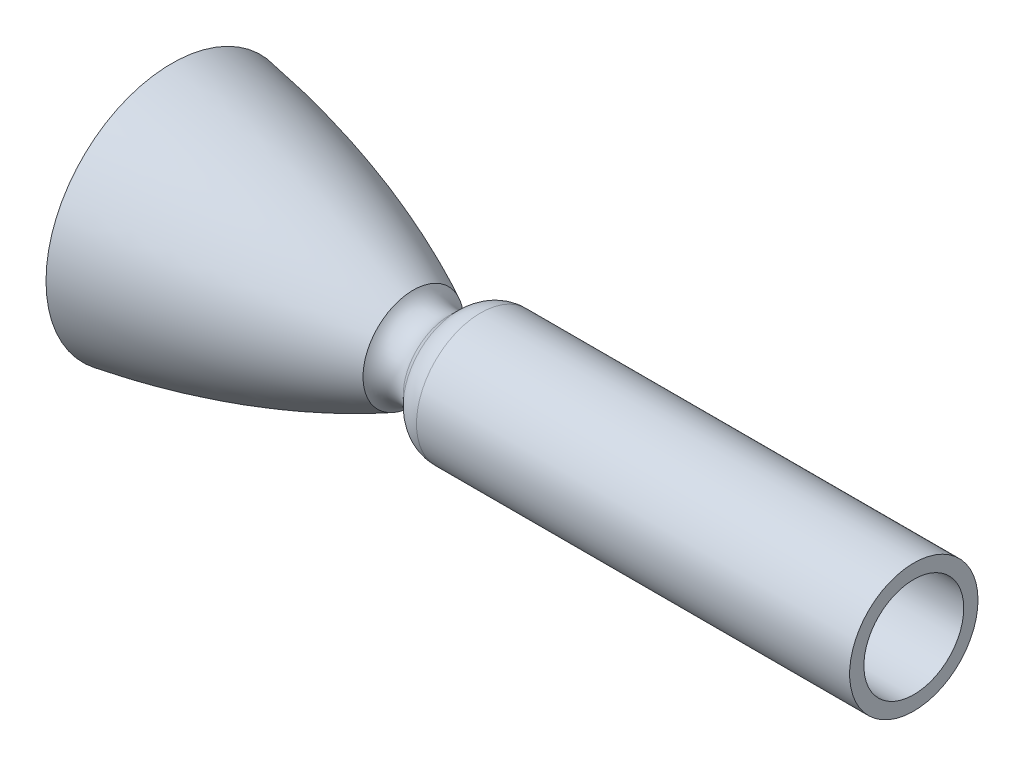
from build123d import *


with BuildPart() as part:
    # Sketch1 → Revolve1 (revolve)
    with BuildSketch(Plane.XY):
        with BuildLine():
            Line((29.403488888, 28), (272.332421076, 28))
            Line((272.332421076, 28), (272.332421076, 36))
            Line((272.332421076, 36), (29.403488888, 36))
            ThreePointArc((29.403488888, 36), (22.515187106, 34.629831585), (16.675566827, 30.727922061))
            Line((16.675566827, 30.727922061), (11.75525661, 25.807611845))
            ThreePointArc((11.75525661, 25.807611845), (1.089034734, 22.083815805), (-8.464094317, 28.114791795))
            add(Edge.make_bspline(
                [(-8.464094317, 28.114791795), (-69.25724143, 58.591574817), (-143.867816982, 70.509434455)],
                knots=[0.092892607, 0.092892607, 0.092892607, 1, 1, 1], degree=2))
            Line((-143.867816982, 70.509434455), (-145.131703302, 62.60990337))
            add(Edge.make_bspline(
                [(0, 14.654088062), (-64.080935915, 49.642177179), (-145.131703302, 62.60990337)],
                knots=[0, 0, 0, 1, 1, 1], degree=2))
            ThreePointArc((0, 14.654088062), (1.240358917, 14.166101456), (2.562868455, 14))
            ThreePointArc((2.562868455, 14), (10.599220534, 15.598529817), (17.41211086, 20.150757595))
            Line((17.41211086, 20.150757595), (22.332421076, 25.071067812))
            ThreePointArc((22.332421076, 25.071067812), (25.576654565, 27.238795325), (29.403488888, 28))
        make_face()
    revolve(axis=Axis((0, 0, 0), (-1, 0, 0)))


solid = part.part
